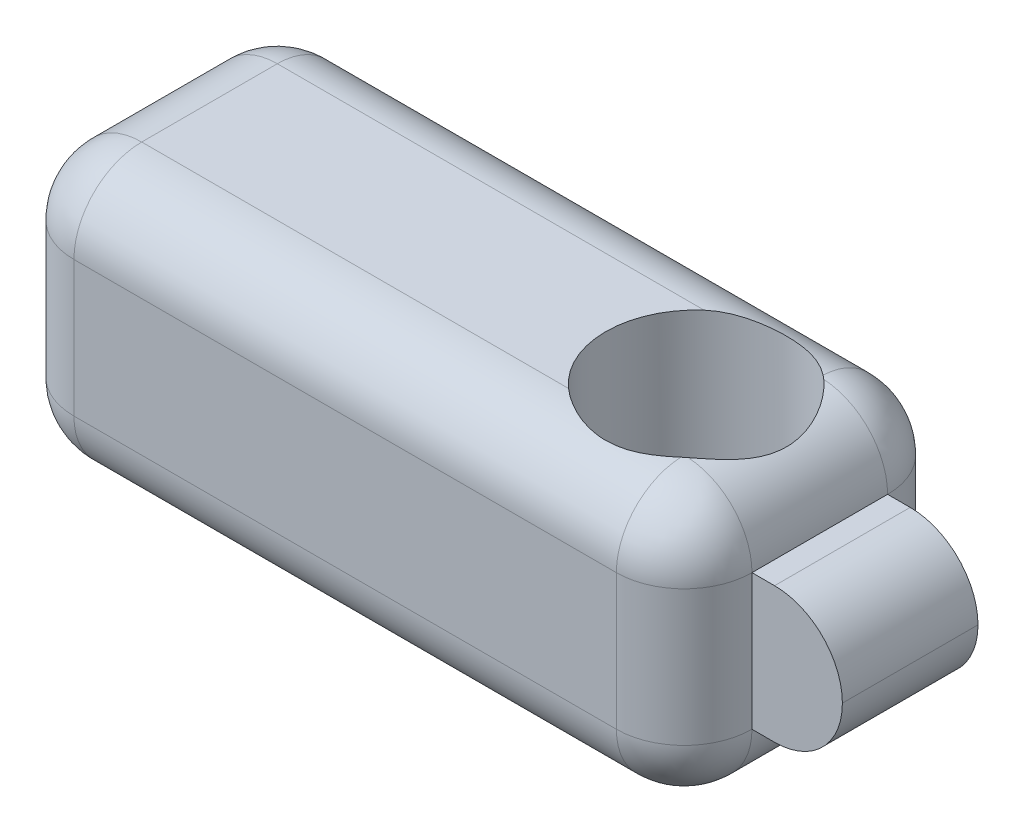
from build123d import *

# Parameters (mm, degrees)
SKETCH1_W           = 150
SKETCH1_H           = 60
BOSS_EXTRUDE3_DEPTH = 60
SKETCH3_R           = 20
CUT_EXTRUDE1_DEPTH  = 100
FILLET1_R           = 15
SKETCH5_R           = 20
CUT_EXTRUDE2_DEPTH  = 40
SKETCH6_W           = 30
SKETCH6_H           = 30
BOSS_EXTRUDE4_DEPTH = 20
FILLET4_R           = 15
FILLET5_R           = 15


# Some blends are built 0.0001 mm under size
with BuildPart() as part:
    # Sketch1 → Boss-Extrude3 (new body)
    with BuildSketch(Plane(origin=(0, 0, 0), x_dir=(1, 0, 0), z_dir=(0, 1, 0))):
        Rectangle(SKETCH1_W, SKETCH1_H)
    extrude(amount=BOSS_EXTRUDE3_DEPTH)

    # Sketch3 → Cut-Extrude1 (cut)
    with BuildSketch(Plane.ZY.offset(75)):
        with Locations((0, 30)):
            Circle(SKETCH3_R)
    extrude(amount=-CUT_EXTRUDE1_DEPTH, mode=Mode.SUBTRACT)

    # Fillet1
    # the kernel refuses this fillet: 15 mm, written as the material it takes off along each edge
    with BuildSketch(Plane(origin=(-60, 45, 15), x_dir=(0, 1, 0), z_dir=(-1, 0, 0))) as fillet1_piece_1_section:
        Polygon((0, 0), (FILLET1_R, 0), (FILLET1_R, -FILLET1_R), (0, -FILLET1_R), align=None)
    fillet1_piece_1 = extrude(amount=FILLET1_R, mode=Mode.PRIVATE)
    fillet1_piece_1 = fillet1_piece_1 - Plane(origin=(-60, 45, 15), x_dir=(0, -0.7071067811865475, -0.7071067811865475), z_dir=(-1, 0, 0)) * Sphere(FILLET1_R, mode=Mode.PRIVATE)
    add(fillet1_piece_1, mode=Mode.SUBTRACT)
    with BuildSketch(Plane(origin=(-60, 45, -15), x_dir=(-1, 0, 0), z_dir=(0, 0, -1))) as fillet1_piece_2_section:
        Polygon((0, 0), (FILLET1_R, 0), (FILLET1_R, FILLET1_R), (0, FILLET1_R), align=None)
    fillet1_piece_2 = extrude(amount=FILLET1_R, mode=Mode.PRIVATE)
    fillet1_piece_2 = fillet1_piece_2 - Plane(origin=(-60, 45, -15), x_dir=(0.7071067811865475, -0.7071067811865475, 0), z_dir=(0, 0, -1)) * Sphere(FILLET1_R, mode=Mode.PRIVATE)
    add(fillet1_piece_2, mode=Mode.SUBTRACT)
    with BuildSketch(Plane(origin=(60, 45, 15), x_dir=(0, 1, 0), z_dir=(1, 0, 0))) as fillet1_piece_3_section:
        Polygon((0, 0), (FILLET1_R, 0), (FILLET1_R, FILLET1_R), (0, FILLET1_R), align=None)
    fillet1_piece_3 = extrude(amount=FILLET1_R, mode=Mode.PRIVATE)
    fillet1_piece_3 = fillet1_piece_3 - Plane(origin=(60, 45, 15), x_dir=(0, -0.7071067811865475, -0.7071067811865475), z_dir=(1, 0, 0)) * Sphere(FILLET1_R, mode=Mode.PRIVATE)
    add(fillet1_piece_3, mode=Mode.SUBTRACT)
    with BuildSketch(Plane(origin=(60, 45, -15), x_dir=(1, 0, 0), z_dir=(0, 0, -1))) as fillet1_piece_4_section:
        Polygon((0, 0), (FILLET1_R, 0), (FILLET1_R, -FILLET1_R), (0, -FILLET1_R), align=None)
    fillet1_piece_4 = extrude(amount=FILLET1_R, mode=Mode.PRIVATE)
    fillet1_piece_4 = fillet1_piece_4 - Plane(origin=(60, 45, -15), x_dir=(-0.7071067811865475, -0.7071067811865475, 0), z_dir=(0, 0, -1)) * Sphere(FILLET1_R, mode=Mode.PRIVATE)
    add(fillet1_piece_4, mode=Mode.SUBTRACT)
    with BuildSketch(Plane(origin=(60, 15, 15), x_dir=(0, -1, 0), z_dir=(1, 0, 0))) as fillet1_piece_5_section:
        Polygon((0, 0), (FILLET1_R, 0), (FILLET1_R, -FILLET1_R), (0, -FILLET1_R), align=None)
    fillet1_piece_5 = extrude(amount=FILLET1_R, mode=Mode.PRIVATE)
    fillet1_piece_5 = fillet1_piece_5 - Plane(origin=(60, 15, 15), x_dir=(0, 0.7071067811865475, -0.7071067811865475), z_dir=(1, 0, 0)) * Sphere(FILLET1_R, mode=Mode.PRIVATE)
    add(fillet1_piece_5, mode=Mode.SUBTRACT)
    with BuildSketch(Plane(origin=(-60, 15, 15), x_dir=(0, -1, 0), z_dir=(-1, 0, 0))) as fillet1_piece_6_section:
        Polygon((0, 0), (FILLET1_R, 0), (FILLET1_R, FILLET1_R), (0, FILLET1_R), align=None)
    fillet1_piece_6 = extrude(amount=FILLET1_R, mode=Mode.PRIVATE)
    fillet1_piece_6 = fillet1_piece_6 - Plane(origin=(-60, 15, 15), x_dir=(0, 0.7071067811865475, -0.7071067811865475), z_dir=(-1, 0, 0)) * Sphere(FILLET1_R, mode=Mode.PRIVATE)
    add(fillet1_piece_6, mode=Mode.SUBTRACT)
    with BuildSketch(Plane(origin=(-60, 15, -15), x_dir=(-1, 0, 0), z_dir=(0, 0, -1))) as fillet1_piece_7_section:
        Polygon((0, 0), (FILLET1_R, 0), (FILLET1_R, -FILLET1_R), (0, -FILLET1_R), align=None)
    fillet1_piece_7 = extrude(amount=FILLET1_R, mode=Mode.PRIVATE)
    fillet1_piece_7 = fillet1_piece_7 - Plane(origin=(-60, 15, -15), x_dir=(0.7071067811865475, 0.7071067811865475, 0), z_dir=(0, 0, -1)) * Sphere(FILLET1_R, mode=Mode.PRIVATE)
    add(fillet1_piece_7, mode=Mode.SUBTRACT)
    with BuildSketch(Plane(origin=(60, 15, -15), x_dir=(1, 0, 0), z_dir=(0, 0, -1))) as fillet1_piece_8_section:
        Polygon((0, 0), (FILLET1_R, 0), (FILLET1_R, FILLET1_R), (0, FILLET1_R), align=None)
    fillet1_piece_8 = extrude(amount=FILLET1_R, mode=Mode.PRIVATE)
    fillet1_piece_8 = fillet1_piece_8 - Plane(origin=(60, 15, -15), x_dir=(-0.7071067811865475, 0.7071067811865475, 0), z_dir=(0, 0, -1)) * Sphere(FILLET1_R, mode=Mode.PRIVATE)
    add(fillet1_piece_8, mode=Mode.SUBTRACT)
    with BuildSketch(Plane(origin=(-75, 60, 15), x_dir=(0, -1, 0), z_dir=(0, 0, -1)), Plane(origin=(75, 60, -15), x_dir=(0, -1, 0), z_dir=(0, 0, 1)), Plane(origin=(-75, 15, 30), x_dir=(0, 0, -1), z_dir=(0, 1, 0)), Plane(origin=(-75, 15, -30), x_dir=(1, 0, 0), z_dir=(0, 1, 0))) as fillet1_piece_9:
        with BuildLine():
            CenterArc((FILLET1_R, -FILLET1_R), FILLET1_R, 90, 90)
            Line((0, -FILLET1_R), (0, 0))
            Line((0, 0), (FILLET1_R, 0))
        make_face()
    extrude(amount=30, mode=Mode.SUBTRACT)
    with BuildSketch(Plane(origin=(60, 60, 30), x_dir=(0, 0, -1), z_dir=(-1, 0, 0)), Plane(origin=(-60, 0, -30), x_dir=(0, 1, 0), z_dir=(1, 0, 0))) as fillet1_piece_10:
        with BuildLine():
            CenterArc((FILLET1_R, FILLET1_R), FILLET1_R, 180, 90)
            Line((0, FILLET1_R), (0, 0))
            Line((0, 0), (FILLET1_R, 0))
        make_face()
    extrude(amount=120, mode=Mode.SUBTRACT)
    with BuildSketch(Plane(origin=(60, 0, 30), x_dir=(0, 0, -1), z_dir=(-1, 0, 0)), Plane(origin=(-60, 60, -30), x_dir=(0, -1, 0), z_dir=(1, 0, 0))) as fillet1_piece_11:
        with BuildLine():
            CenterArc((FILLET1_R, -FILLET1_R), FILLET1_R, 90, 90)
            Line((0, -FILLET1_R), (0, 0))
            Line((0, 0), (FILLET1_R, 0))
        make_face()
    extrude(amount=120, mode=Mode.SUBTRACT)
    with BuildSketch(Plane(origin=(-75, 0, 15), x_dir=(0, 1, 0), z_dir=(0, 0, -1)), Plane(origin=(75, 0, -15), x_dir=(0, 1, 0), z_dir=(0, 0, 1)), Plane(origin=(75, 15, 30), x_dir=(0, 0, -1), z_dir=(0, 1, 0)), Plane(origin=(75, 15, -30), x_dir=(-1, 0, 0), z_dir=(0, 1, 0))) as fillet1_piece_12:
        with BuildLine():
            CenterArc((FILLET1_R, FILLET1_R), FILLET1_R, 180, 90)
            Line((0, FILLET1_R), (0, 0))
            Line((0, 0), (FILLET1_R, 0))
        make_face()
    extrude(amount=30, mode=Mode.SUBTRACT)

    # Sketch5 → Cut-Extrude2 (cut)
    with BuildSketch(Plane(origin=(0, 60, 0), x_dir=(1, 0, 0), z_dir=(0, 1, 0))):
        with Locations(Location((47.646230656, 0, 0), (0, 0, 270))):
            Circle(SKETCH5_R)
    extrude(amount=-CUT_EXTRUDE2_DEPTH, mode=Mode.SUBTRACT)

    # Sketch6 → Boss-Extrude4 (add)
    with BuildSketch(Plane(origin=(75, 0, 0), x_dir=(0, 0, -1), z_dir=(1, 0, 0))):
        with Locations((0, 30)):
            Rectangle(SKETCH6_W, SKETCH6_H)
    extrude(amount=BOSS_EXTRUDE4_DEPTH)

    # Fillet4
    fillet4_edges = [part.edges().sort_by_distance(p)[0] for p in [
        (95, 15, 0),
    ]]
    fillet(fillet4_edges, radius=FILLET4_R)

    # Fillet5
    fillet5_edges = [part.edges().sort_by_distance(p)[0] for p in [
        (95, 45, 0),
    ]]
    fillet(fillet5_edges, radius=FILLET5_R - 0.0001)  # a hair under: the kernel refuses the full size


solid = part.part
